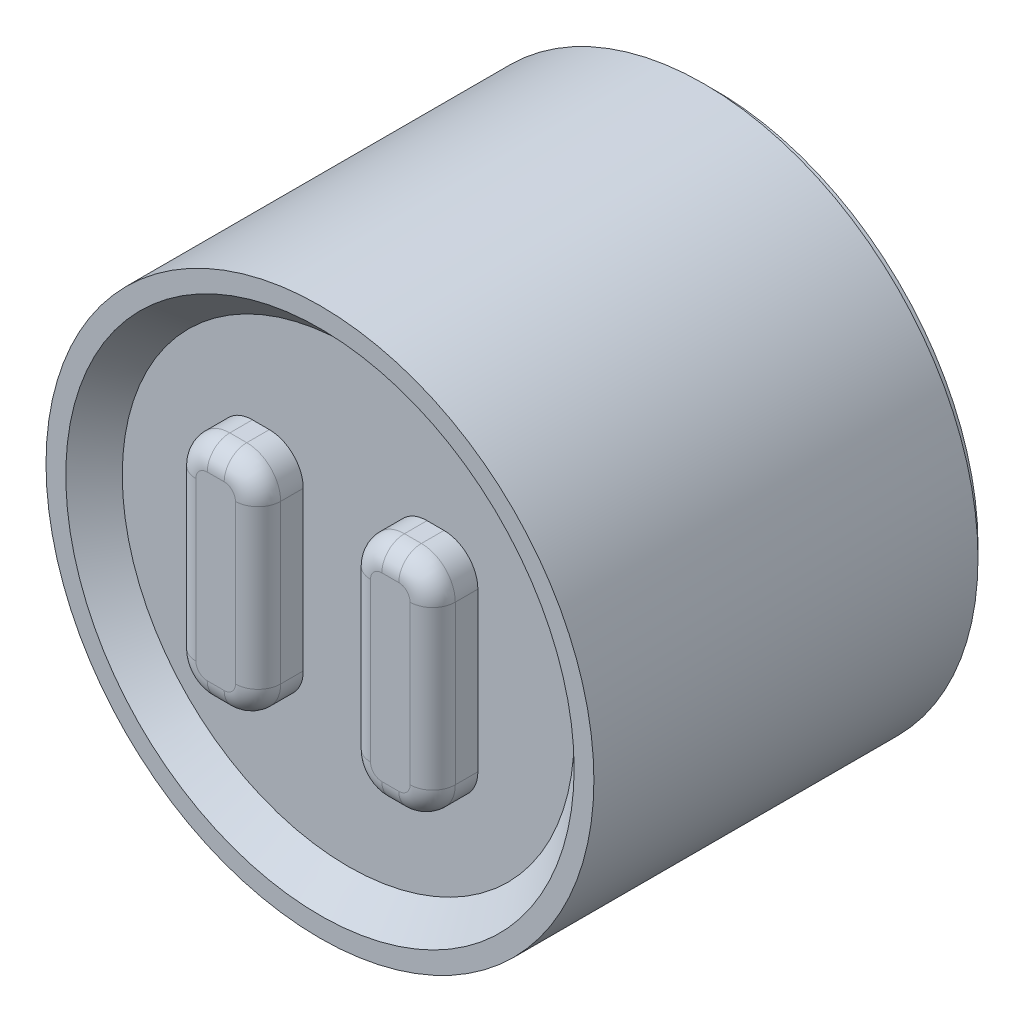
from build123d import *

# Parameters (mm, degrees)
SKETCH_1_R          = 4.85
EXTRUDE_1_DEPTH     = 6.8
SKETCH_2_R          = 4
CUT_EXTRUDE_1_DEPTH = 0.5
CHAMFER_1_SIZE      = 0.5
EXTRUDE_2_DEPTH     = 0.8
FILLET_1_R          = 0.4
SKETCH_4_R          = 4.65
EXTRUDE_3_DEPTH     = 0.2


with BuildPart() as part:
    # Эскиз1 → Бобышка-Вытянуть1 (new body)
    with BuildSketch(Plane.XY):
        Circle(SKETCH_1_R)
    extrude(amount=EXTRUDE_1_DEPTH)

    # Эскиз2 → Вырез-Вытянуть1 (cut)
    with BuildSketch(Plane.XY.offset(6.8)):
        Circle(SKETCH_2_R)
    extrude(amount=-CUT_EXTRUDE_1_DEPTH, mode=Mode.SUBTRACT)

    # Фаска1
    chamfer_1_edges = [part.edges().sort_by_distance(p)[0] for p in [
        (-4, 0, 6.8),
    ]]
    chamfer(chamfer_1_edges, length=CHAMFER_1_SIZE - 0.0001)  # a hair under: the kernel refuses the full size

    # Эскиз3 → Бобышка-Вытянуть2 (add)
    with BuildSketch(Plane.XY.offset(6.3)):
        with BuildLine():
            Line((-1.695763296, 2), (-1.395763296, 2))
            ThreePointArc((-1.395763296, 2), (-0.971499227, 1.824264069), (-0.795763296, 1.4))
            Line((-0.795763296, 1.4), (-0.795763296, -1.4))
            ThreePointArc((-0.795763296, -1.4), (-0.971499227, -1.824264069), (-1.395763296, -2))
            Line((-1.395763296, -2), (-1.695763296, -2))
            ThreePointArc((-1.695763296, -2), (-2.120027365, -1.824264069), (-2.295763296, -1.4))
            Line((-2.295763296, -1.4), (-2.295763296, 1.4))
            ThreePointArc((-2.295763296, 1.4), (-2.120027365, 1.824264069), (-1.695763296, 2))
        make_face()
        with BuildLine():
            Line((0.795763296, 1.4), (0.795763296, -1.4))
            ThreePointArc((0.795763296, -1.4), (0.971499227, -1.824264069), (1.395763296, -2))
            Line((1.395763296, -2), (1.695763296, -2))
            ThreePointArc((1.695763296, -2), (2.120027365, -1.824264069), (2.295763296, -1.4))
            Line((2.295763296, -1.4), (2.295763296, 1.4))
            ThreePointArc((2.295763296, 1.4), (2.120027365, 1.824264069), (1.695763296, 2))
            Line((1.695763296, 2), (1.395763296, 2))
            ThreePointArc((1.395763296, 2), (0.971499227, 1.824264069), (0.795763296, 1.4))
        make_face()
    extrude(amount=EXTRUDE_2_DEPTH)

    # Скругление1
    fillet_1_edges = [part.edges().sort_by_distance(p)[0] for p in [
        (-2.120027365, -1.824264069, 7.1),
        (-1.545763296, -2, 7.1),
        (-0.971499227, -1.824264069, 7.1),
        (-0.795763296, 0, 7.1),
        (-0.971499227, 1.824264069, 7.1),
        (-1.545763296, 2, 7.1),
        (-2.120027365, 1.824264069, 7.1),
        (-2.295763296, 0, 7.1),
        (2.120027365, 1.824264069, 7.1),
        (1.545763296, 2, 7.1),
        (0.971499227, 1.824264069, 7.1),
        (0.795763296, 0, 7.1),
        (0.971499227, -1.824264069, 7.1),
        (1.545763296, -2, 7.1),
        (2.120027365, -1.824264069, 7.1),
        (2.295763296, 0, 7.1),
    ]]
    fillet(fillet_1_edges, radius=FILLET_1_R)

    # Эскиз4 → Бобышка-Вытянуть3 (add)
    with BuildSketch(Plane(origin=(0, 0, 0), x_dir=(-1, 0, 0), z_dir=(0, 0, -1))):
        with Locations(Location((0, 0, 0), (0, 0, 180))):
            Circle(SKETCH_4_R)
    extrude(amount=EXTRUDE_3_DEPTH)


solid = part.part
